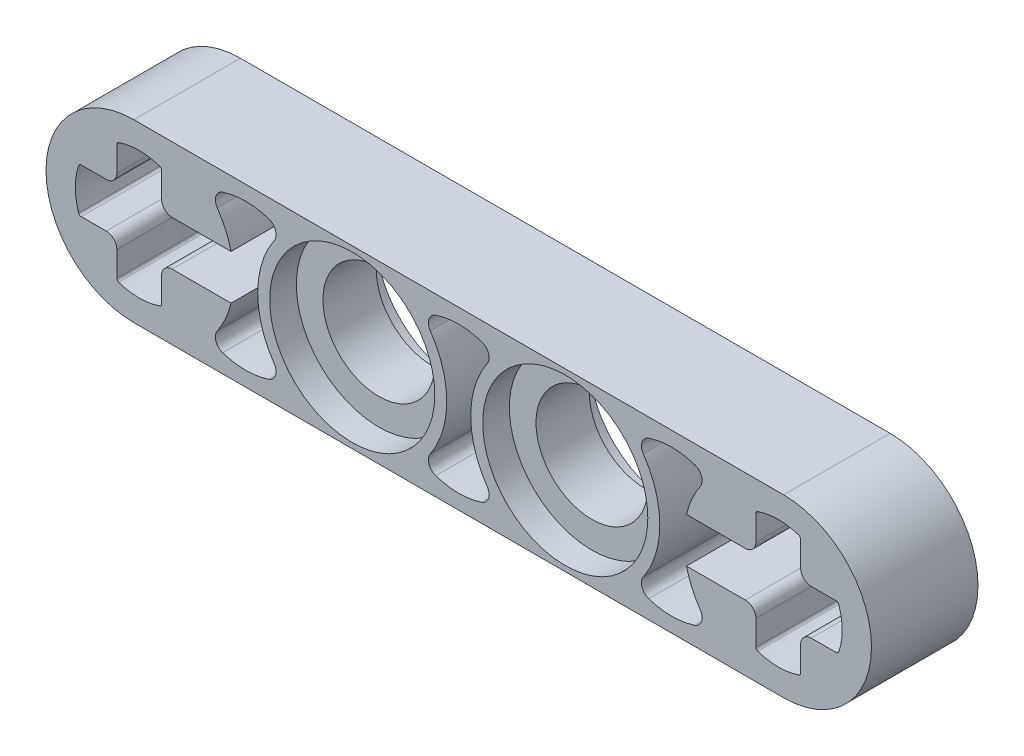
from build123d import *

# Parameters (mm, degrees)
SKETCH1_R           = 2.1
BOSS_EXTRUDE1_DEPTH = 2
SKETCH2_R           = 3.1
CUT_EXTRUDE1_DEPTH  = 1


with BuildPart() as part:
    # Sketch1 → Boss-Extrude1 (new, symmetric)
    with BuildSketch(Plane.XY):
        with BuildLine():
            Line((12.2, 3.3), (-12.2, 3.3))
            ThreePointArc((-12.2, 3.3), (-15.5, 0), (-12.2, -3.3))
            Line((-12.2, -3.3), (12.2, -3.3))
            ThreePointArc((12.2, -3.3), (15.5, 0), (12.2, 3.3))
        make_face()
        with BuildLine():
            Line((-14.177705214, 0.84), (-13.24, 0.84))
            ThreePointArc((-13.24, 0.84), (-12.957157288, 0.957157288), (-12.84, 1.24))
            Line((-12.84, 1.24), (-12.84, 2.177705214))
            ThreePointArc((-12.84, 2.177705214), (-12.821293884, 2.235940121), (-12.772173913, 2.27238805))
            ThreePointArc((-12.772173913, 2.27238805), (-12, 2.4), (-11.227826087, 2.27238805))
            ThreePointArc((-11.227826087, 2.27238805), (-11.178706116, 2.235940121), (-11.16, 2.177705214))
            Line((-11.16, 2.177705214), (-11.16, 1.24))
            ThreePointArc((-11.16, 1.24), (-11.042842712, 0.957157288), (-10.76, 0.84))
            Line((-10.76, 0.84), (-9.822294786, 0.84))
            Line((-9.822294786, 0.84), (-9.751800721, 0.84))
            Line((-9.751800721, 0.84), (-8.55081169, 0.84))
            ThreePointArc((-8.55081169, 0.84), (-8.757752494, 1.445797742), (-9.070126582, 2.004580194))
            ThreePointArc((-9.070126582, 2.004580194), (-9.119033599, 2.358251088), (-8.865957447, 2.610099174))
            ThreePointArc((-8.865957447, 2.610099174), (-8, 2.75), (-7.134042553, 2.610099174))
            ThreePointArc((-7.134042553, 2.610099174), (-6.880966401, 2.358251088), (-6.929873418, 2.004580194))
            ThreePointArc((-6.929873418, 2.004580194), (-7.55, 0), (-6.929873418, -2.004580194))
            ThreePointArc((-6.929873418, -2.004580194), (-6.880966401, -2.358251088), (-7.134042553, -2.610099174))
            ThreePointArc((-7.134042553, -2.610099174), (-8, -2.75), (-8.865957447, -2.610099174))
            ThreePointArc((-8.865957447, -2.610099174), (-9.119033599, -2.358251088), (-9.070126582, -2.004580194))
            ThreePointArc((-9.070126582, -2.004580194), (-8.757752494, -1.445797742), (-8.55081169, -0.84))
            Line((-8.55081169, -0.84), (-9.751800721, -0.84))
            Line((-9.751800721, -0.84), (-9.822294786, -0.84))
            Line((-9.822294786, -0.84), (-10.76, -0.84))
            ThreePointArc((-10.76, -0.84), (-11.042842712, -0.957157288), (-11.16, -1.24))
            Line((-11.16, -1.24), (-11.16, -2.177705214))
            ThreePointArc((-11.16, -2.177705214), (-11.178706116, -2.235940121), (-11.227826087, -2.27238805))
            ThreePointArc((-11.227826087, -2.27238805), (-12, -2.4), (-12.772173913, -2.27238805))
            ThreePointArc((-12.772173913, -2.27238805), (-12.821293884, -2.235940121), (-12.84, -2.177705214))
            Line((-12.84, -2.177705214), (-12.84, -1.24))
            ThreePointArc((-12.84, -1.24), (-12.957157288, -0.957157288), (-13.24, -0.84))
            Line((-13.24, -0.84), (-14.177705214, -0.84))
            ThreePointArc((-14.177705214, -0.84), (-14.235940121, -0.821293884), (-14.27238805, -0.772173913))
            ThreePointArc((-14.27238805, -0.772173913), (-14.4, 0), (-14.27238805, 0.772173913))
            ThreePointArc((-14.27238805, 0.772173913), (-14.235940121, 0.821293884), (-14.177705214, 0.84))
        make_face(mode=Mode.SUBTRACT)
        with BuildLine():
            ThreePointArc((0.865957447, -2.610099174), (0, -2.75), (-0.865957447, -2.610099174))
            ThreePointArc((-0.865957447, -2.610099174), (-1.119033599, -2.358251088), (-1.070126582, -2.004580194))
            ThreePointArc((-1.070126582, -2.004580194), (-0.45, 0), (-1.070126582, 2.004580194))
            ThreePointArc((-1.070126582, 2.004580194), (-1.119033599, 2.358251088), (-0.865957447, 2.610099174))
            ThreePointArc((-0.865957447, 2.610099174), (0, 2.75), (0.865957447, 2.610099174))
            ThreePointArc((0.865957447, 2.610099174), (1.119033599, 2.358251088), (1.070126582, 2.004580194))
            ThreePointArc((1.070126582, 2.004580194), (0.45, 0), (1.070126582, -2.004580194))
            ThreePointArc((1.070126582, -2.004580194), (1.119033599, -2.358251088), (0.865957447, -2.610099174))
        make_face(mode=Mode.SUBTRACT)
        with BuildLine():
            Line((12.84, 2.177705214), (12.84, 1.24))
            ThreePointArc((12.84, 1.24), (12.957157288, 0.957157288), (13.24, 0.84))
            Line((13.24, 0.84), (14.177705214, 0.84))
            ThreePointArc((14.177705214, 0.84), (14.235940121, 0.821293884), (14.27238805, 0.772173913))
            ThreePointArc((14.27238805, 0.772173913), (14.4, 0), (14.27238805, -0.772173913))
            ThreePointArc((14.27238805, -0.772173913), (14.235940121, -0.821293884), (14.177705214, -0.84))
            Line((14.177705214, -0.84), (13.24, -0.84))
            ThreePointArc((13.24, -0.84), (12.957157288, -0.957157288), (12.84, -1.24))
            Line((12.84, -1.24), (12.84, -2.177705214))
            ThreePointArc((12.84, -2.177705214), (12.821293884, -2.235940121), (12.772173913, -2.27238805))
            ThreePointArc((12.772173913, -2.27238805), (12, -2.4), (11.227826087, -2.27238805))
            ThreePointArc((11.227826087, -2.27238805), (11.178706116, -2.235940121), (11.16, -2.177705214))
            Line((11.16, -2.177705214), (11.16, -1.24))
            ThreePointArc((11.16, -1.24), (11.042842712, -0.957157288), (10.76, -0.84))
            Line((10.76, -0.84), (9.822294786, -0.84))
            Line((9.822294786, -0.84), (9.751800721, -0.84))
            Line((9.751800721, -0.84), (8.55081169, -0.84))
            ThreePointArc((8.55081169, -0.84), (8.757752494, -1.445797742), (9.070126582, -2.004580194))
            ThreePointArc((9.070126582, -2.004580194), (9.119033599, -2.358251088), (8.865957447, -2.610099174))
            ThreePointArc((8.865957447, -2.610099174), (8, -2.75), (7.134042553, -2.610099174))
            ThreePointArc((7.134042553, -2.610099174), (6.880966401, -2.358251088), (6.929873418, -2.004580194))
            ThreePointArc((6.929873418, -2.004580194), (7.55, 0), (6.929873418, 2.004580194))
            ThreePointArc((6.929873418, 2.004580194), (6.880966401, 2.358251088), (7.134042553, 2.610099174))
            ThreePointArc((7.134042553, 2.610099174), (8, 2.75), (8.865957447, 2.610099174))
            ThreePointArc((8.865957447, 2.610099174), (9.119033599, 2.358251088), (9.070126582, 2.004580194))
            ThreePointArc((9.070126582, 2.004580194), (8.757752494, 1.445797742), (8.55081169, 0.84))
            Line((8.55081169, 0.84), (9.751800721, 0.84))
            Line((9.751800721, 0.84), (9.822294786, 0.84))
            Line((9.822294786, 0.84), (10.76, 0.84))
            ThreePointArc((10.76, 0.84), (11.042842712, 0.957157288), (11.16, 1.24))
            Line((11.16, 1.24), (11.16, 2.177705214))
            ThreePointArc((11.16, 2.177705214), (11.178706116, 2.235940121), (11.227826087, 2.27238805))
            ThreePointArc((11.227826087, 2.27238805), (12, 2.4), (12.772173913, 2.27238805))
            ThreePointArc((12.772173913, 2.27238805), (12.821293884, 2.235940121), (12.84, 2.177705214))
        make_face(mode=Mode.SUBTRACT)
        with Locations((-4, 0)):
            Circle(SKETCH1_R, mode=Mode.SUBTRACT)
        with Locations((4, 0)):
            Circle(SKETCH1_R, mode=Mode.SUBTRACT)
    extrude(amount=BOSS_EXTRUDE1_DEPTH, both=True)

    # Sketch2 → Cut-Extrude1 (cut)
    with BuildSketch(Plane.XY.offset(2)):
        with Locations((-4, 0)):
            Circle(SKETCH2_R)
        with Locations((4, 0)):
            Circle(SKETCH2_R)
    cut_extrude1 = extrude(amount=-CUT_EXTRUDE1_DEPTH, mode=Mode.SUBTRACT)

    # Mirror1: Cut-Extrude1 across plane
    add(cut_extrude1.mirror(Plane.XY), mode=Mode.SUBTRACT)


solid = part.part
